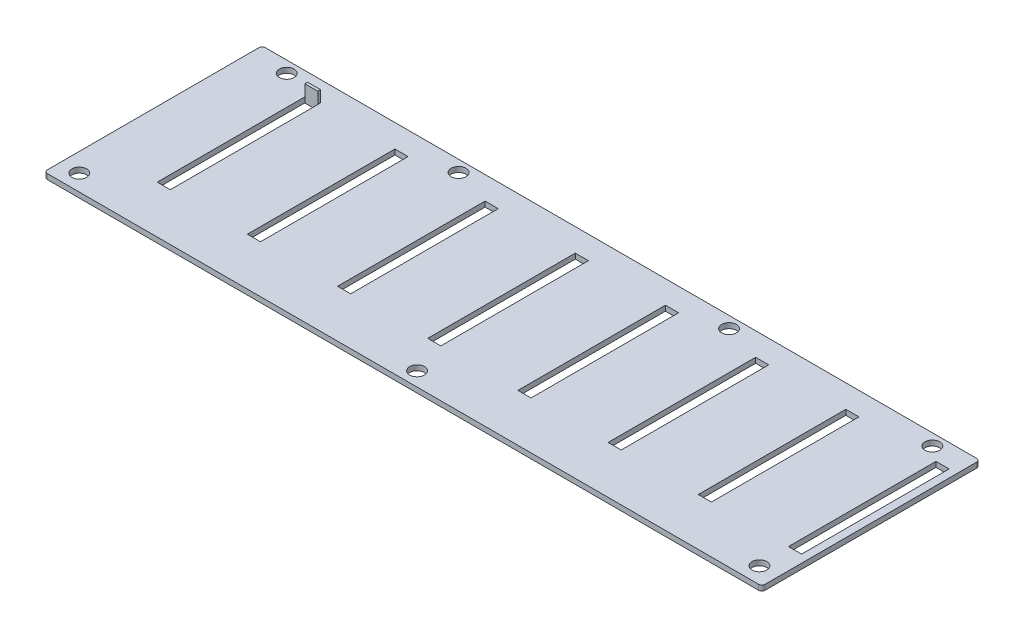
from build123d import *

# Parameters (mm, degrees)
SKETCH1_W           = 218.9
SKETCH1_H           = 66.5
SKETCH1_R           = 2.25
SKETCH1_W_2         = 4
SKETCH1_H_2         = 45
BOSS_EXTRUDE1_DEPTH = 1.6
FILLET1_R           = 1
SKETCH3_W           = 4
SKETCH3_H           = 0.831639971
BOSS_EXTRUDE2_DEPTH = 5.1


with BuildPart() as part:
    # Sketch1 → Boss-Extrude1 (new body)
    with BuildSketch(Plane(origin=(0, 0, 0), x_dir=(1, 0, 0), z_dir=(0, 1, 0))):
        with Locations((109.45, 33.25)):
            Rectangle(SKETCH1_W, SKETCH1_H)
        with Locations((11, 63)):
            Circle(SKETCH1_R, mode=Mode.SUBTRACT)
        with Locations((63.4, 63)):
            Circle(SKETCH1_R, mode=Mode.SUBTRACT)
        with Locations((145.9, 63)):
            Circle(SKETCH1_R, mode=Mode.SUBTRACT)
        with Locations((207.9, 63)):
            Circle(SKETCH1_R, mode=Mode.SUBTRACT)
        with Locations((5.75, 5)):
            Circle(SKETCH1_R, mode=Mode.SUBTRACT)
        with Locations((109.45, 4.3)):
            Circle(SKETCH1_R, mode=Mode.SUBTRACT)
        with Locations((213.15, 5)):
            Circle(SKETCH1_R, mode=Mode.SUBTRACT)
        with Locations((22, 37)):
            Rectangle(SKETCH1_W_2, SKETCH1_H_2, mode=Mode.SUBTRACT)
        with Locations((49.5, 37)):
            Rectangle(SKETCH1_W_2, SKETCH1_H_2, mode=Mode.SUBTRACT)
        with Locations((77, 37)):
            Rectangle(SKETCH1_W_2, SKETCH1_H_2, mode=Mode.SUBTRACT)
        with Locations((104.5, 37)):
            Rectangle(SKETCH1_W_2, SKETCH1_H_2, mode=Mode.SUBTRACT)
        with Locations((132, 37)):
            Rectangle(SKETCH1_W_2, SKETCH1_H_2, mode=Mode.SUBTRACT)
        with Locations((159.5, 37)):
            Rectangle(SKETCH1_W_2, SKETCH1_H_2, mode=Mode.SUBTRACT)
        with Locations((187, 37)):
            Rectangle(SKETCH1_W_2, SKETCH1_H_2, mode=Mode.SUBTRACT)
        with Locations((214.5, 37)):
            Rectangle(SKETCH1_W_2, SKETCH1_H_2, mode=Mode.SUBTRACT)
    extrude(amount=BOSS_EXTRUDE1_DEPTH)

    # Fillet1
    fillet1_edges = [part.edges().sort_by_distance(p)[0] for p in [
        (218.9, 0.8, -66.5),
        (218.9, 0.8, 0),
        (0, 0.8, 0),
        (0, 0.8, -66.5),
    ]]
    fillet(fillet1_edges, radius=FILLET1_R)

    # Sketch3 → Boss-Extrude2 (add)
    with BuildSketch(Plane(origin=(0, 0, 0), x_dir=(1, 0, 0), z_dir=(0, 1, 0))):
        with Locations((22, 59.915819986)):
            Rectangle(SKETCH3_W, SKETCH3_H)
    extrude(amount=BOSS_EXTRUDE2_DEPTH)


solid = part.part
